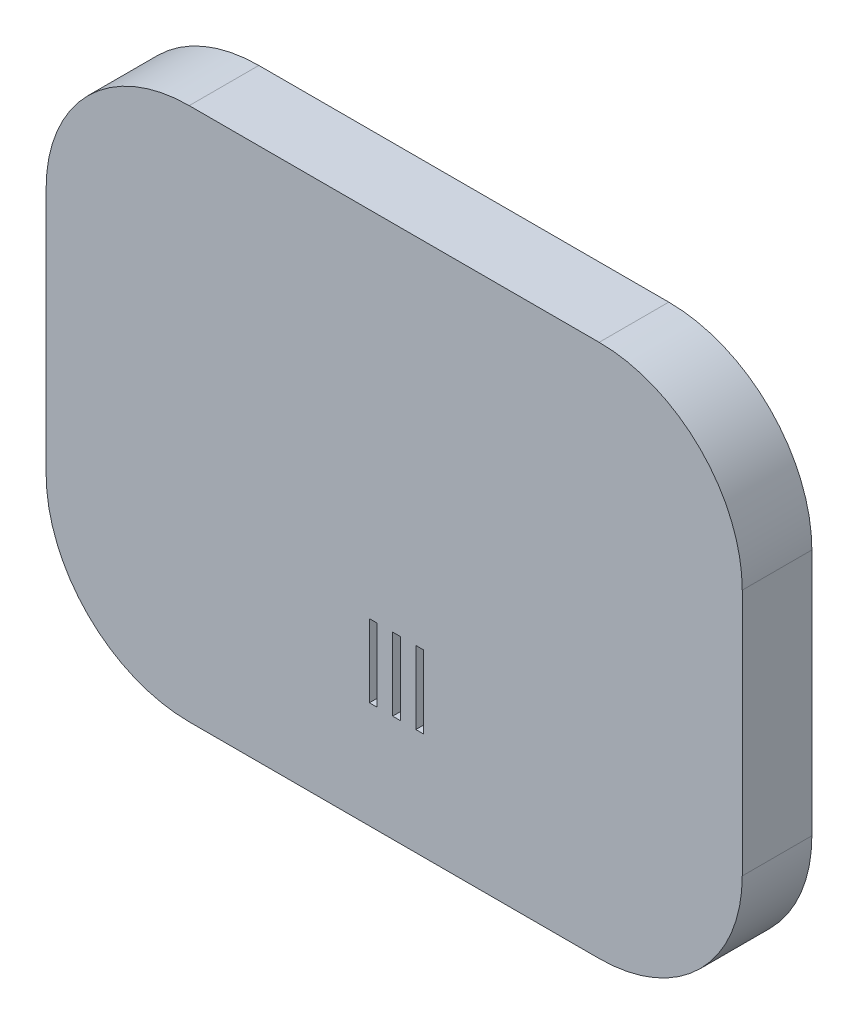
from build123d import *

# Parameters (mm, degrees)
EXTRUDE_THIN1_DEPTH = 7
BOSS_EXTRUDE1_DEPTH = 2
SKETCH3_R           = 7.55
SKETCH3_R_2         = 6.05
EXTRUDE_THIN2_DEPTH = 5
FILLET1_R           = 5
SKETCH4_W           = 1
SKETCH4_H           = 9.419182822
CUT_EXTRUDE1_DEPTH  = 818.680940253


with BuildPart() as part:
    # Sketch1 → Extrude-Thin1 (new body)
    with BuildSketch(Plane.XY):
        with BuildLine():
            Line((122.537316884, 771.044811258), (122.537316884, 739.044811258))
            ThreePointArc((122.537316884, 739.044811258), (127.955841432, 725.963335806), (141.037316884, 720.544811258))
            Line((141.037316884, 720.544811258), (194.037316884, 720.544811258))
            ThreePointArc((194.037316884, 720.544811258), (207.118792336, 725.963335806), (212.537316884, 739.044811258))
            Line((212.537316884, 739.044811258), (212.537316884, 771.044811258))
            ThreePointArc((212.537316884, 771.044811258), (207.118792336, 784.12628671), (194.037316884, 789.544811258))
            Line((194.037316884, 789.544811258), (141.037316884, 789.544811258))
            ThreePointArc((141.037316884, 789.544811258), (127.955841432, 784.12628671), (122.537316884, 771.044811258))
        make_face()
        with BuildLine():
            Line((124.037316884, 771.044811258), (124.037316884, 739.044811258))
            ThreePointArc((124.037316884, 739.044811258), (129.016501604, 727.023995978), (141.037316884, 722.044811258))
            Line((141.037316884, 722.044811258), (194.037316884, 722.044811258))
            ThreePointArc((194.037316884, 722.044811258), (206.058132165, 727.023995978), (211.037316884, 739.044811258))
            Line((211.037316884, 739.044811258), (211.037316884, 771.044811258))
            ThreePointArc((211.037316884, 771.044811258), (206.058132165, 783.065626538), (194.037316884, 788.044811258))
            Line((194.037316884, 788.044811258), (141.037316884, 788.044811258))
            ThreePointArc((141.037316884, 788.044811258), (129.016501604, 783.065626538), (124.037316884, 771.044811258))
        make_face(mode=Mode.SUBTRACT)
    extrude(amount=EXTRUDE_THIN1_DEPTH)

    # Sketch2 → Boss-Extrude1 (add)
    with BuildSketch(Plane.XY.offset(7)):
        with BuildLine():
            Line((122.537316884, 771.044811258), (122.537316884, 739.044811258))
            ThreePointArc((122.537316884, 739.044811258), (127.955841432, 725.963335806), (141.037316884, 720.544811258))
            Line((141.037316884, 720.544811258), (194.037316884, 720.544811258))
            ThreePointArc((194.037316884, 720.544811258), (207.118792336, 725.963335806), (212.537316884, 739.044811258))
            Line((212.537316884, 739.044811258), (212.537316884, 771.044811258))
            ThreePointArc((212.537316884, 771.044811258), (207.118792336, 784.12628671), (194.037316884, 789.544811258))
            Line((194.037316884, 789.544811258), (141.037316884, 789.544811258))
            ThreePointArc((141.037316884, 789.544811258), (127.955841432, 784.12628671), (122.537316884, 771.044811258))
        make_face()
    extrude(amount=BOSS_EXTRUDE1_DEPTH)

    # Sketch3 → Extrude-Thin2 (add)
    with BuildSketch(Plane(origin=(0, 0, 7), x_dir=(-1, 0, 0), z_dir=(0, 0, -1))):
        with Locations((-167.537316884, 739.044811258)):
            Circle(SKETCH3_R)
        with Locations((-167.537316884, 739.044811258)):
            Circle(SKETCH3_R_2, mode=Mode.SUBTRACT)
    extrude(amount=EXTRUDE_THIN2_DEPTH)

    # Fillet1
    fillet1_edges = [part.edges().sort_by_distance(p)[0] for p in [
        (175.087316884, 739.044811258, 7),
    ]]
    fillet(fillet1_edges, radius=FILLET1_R - 0.0001)  # a hair under: the kernel refuses the full size

    # Sketch4 → Cut-Extrude1 (cut, through all)
    with BuildSketch(Plane(origin=(0, 0, 7), x_dir=(-1, 0, 0), z_dir=(0, 0, -1))):
        with Locations((-170.834980474, 739.044811258)):
            Rectangle(SKETCH4_W, SKETCH4_H)
        with Locations((-167.834980474, 739.044811258)):
            Rectangle(SKETCH4_W, SKETCH4_H)
        with Locations((-164.834980474, 739.044811258)):
            Rectangle(SKETCH4_W, SKETCH4_H)
    extrude(amount=-CUT_EXTRUDE1_DEPTH, mode=Mode.SUBTRACT)


solid = part.part
